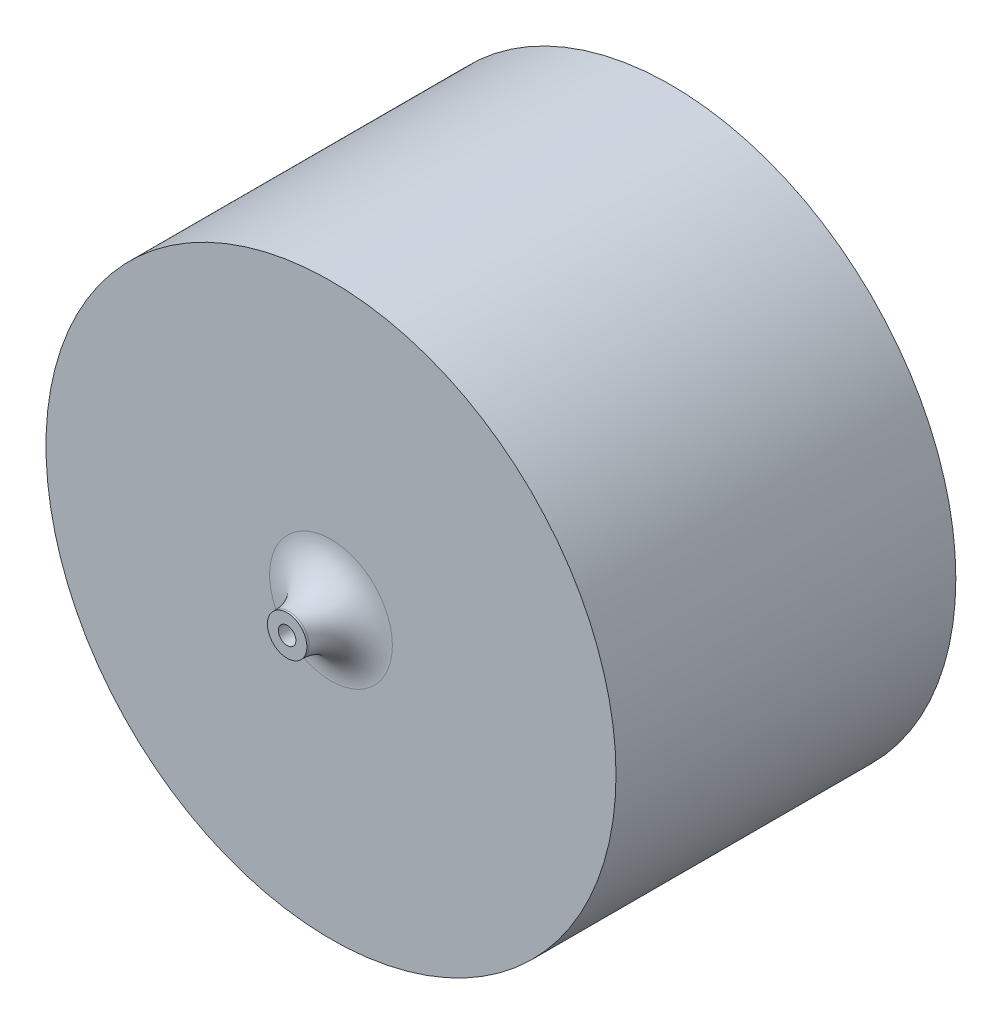
from build123d import *


with BuildPart() as part:
    # Sketch1 → Revolve1 (revolve)
    with BuildSketch(Plane(origin=(0, 0, 0), x_dir=(0, 0, -1), z_dir=(1, 0, 0))):
        with BuildLine():
            Line((6.35, 1.016), (6.35, 26.924))
            ThreePointArc((6.35, 26.924), (7.763502674, 30.336497326), (11.176, 31.75))
            Line((11.176, 31.75), (44.45, 31.75))
            Line((44.45, 31.75), (44.45, 33.02))
            Line((44.45, 33.02), (5.08, 33.02))
            Line((5.08, 33.02), (5.08, 7.112))
            ThreePointArc((5.08, 7.112), (3.666497326, 3.699502674), (0.254, 2.286))
            Line((0.254, 2.286), (0, 2.286))
            Line((0, 2.286), (0, 1.016))
            Line((0, 1.016), (6.35, 1.016))
        make_face()
    revolve(axis=Axis((0, 0, 0), (0, 0, -1)))


solid = part.part
